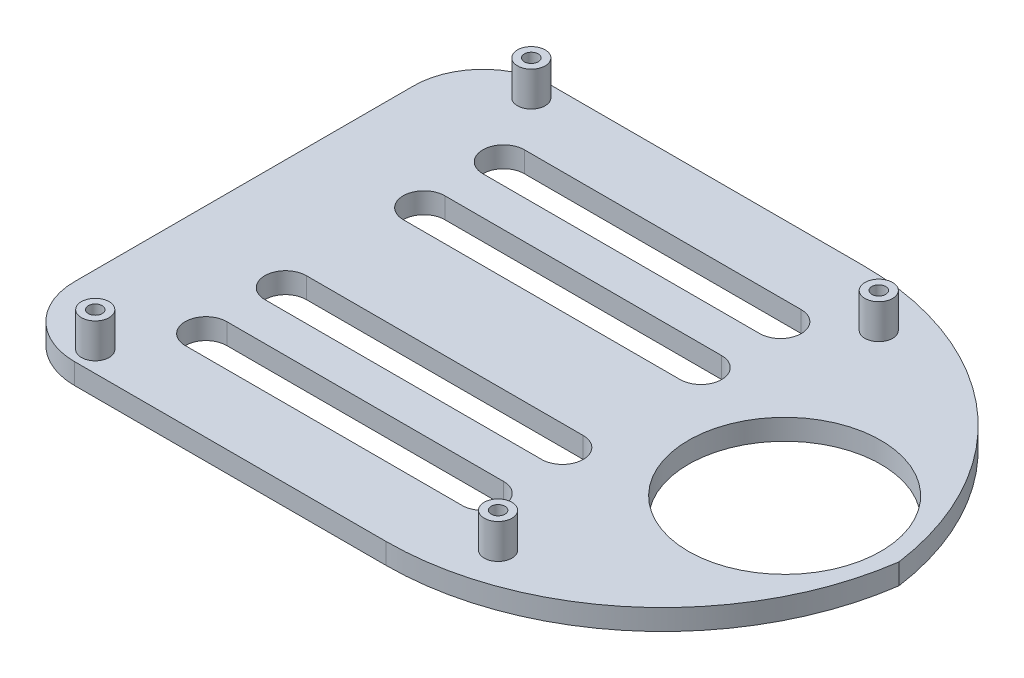
from build123d import *

# Parameters (mm, degrees)
ESBO_O1_W                = 95
ESBO_O1_H                = 69
RESSALTO_EXTRUS_O1_DEPTH = 3
ESBO_O2_R                = 13.9
CORTE_EXTRUS_O1_DEPTH    = 59.783501087
ESBO_O4_R                = 1
CORTE_EXTRUS_O2_DEPTH    = 59.783501087
RESSALTO_EXTRUS_O2_START = 5
ESBO_O5_R                = 2
ESBO_O5_R_2              = 1
RESSALTO_EXTRUS_O2_DEPTH = 5
FILETE1_R                = 40
FILETE2_R                = 10
CORTE_EXTRUS_O3_DEPTH    = 59.919436521


with BuildPart() as part:
    # Esboço1 → Ressalto-extrusão1 (new body)
    with BuildSketch(Plane(origin=(0, 0, 0), x_dir=(1, 0, 0), z_dir=(0, 1, 0))):
        Rectangle(ESBO_O1_W, ESBO_O1_H)
    extrude(amount=RESSALTO_EXTRUS_O1_DEPTH)

    # Esboço2 → Corte-extrusão1 (cut, through all)
    with BuildSketch(Plane(origin=(0, 3, 0), x_dir=(1, 0, 0), z_dir=(0, 1, 0))):
        with Locations(Location((30.6, 0, 0), (0, 0, 270))):
            Circle(ESBO_O2_R)
    extrude(amount=-CORTE_EXTRUS_O1_DEPTH, mode=Mode.SUBTRACT)

    # Esboço4 → Corte-extrusão2 (cut, through all)
    with BuildSketch(Plane(origin=(0, 3, 0), x_dir=(1, 0, 0), z_dir=(0, 1, 0))):
        with Locations(Location((16.7, 27.5, 0), (0, 0, 270))):
            Circle(ESBO_O4_R)
        with Locations(Location((16.7, -27.5, 0), (0, 0, 90))):
            Circle(ESBO_O4_R)
        with Locations(Location((-37.5, 31.5, 0), (0, 0, 270))):
            Circle(ESBO_O4_R)
        with Locations(Location((-37.5, -31.5, 0), (0, 0, 90))):
            Circle(ESBO_O4_R)
    extrude(amount=-CORTE_EXTRUS_O2_DEPTH, mode=Mode.SUBTRACT)

    # Esboço5 → Ressalto-extrusão2 (add)
    # profile 1 of 4: a face of its own
    with BuildSketch(Plane(origin=(0, 3, 0), x_dir=(1, 0, 0), z_dir=(0, 1, 0)).offset(RESSALTO_EXTRUS_O2_START)):
        with Locations(Location((-37.5, 31.5, 0), (0, 0, 270))):
            Circle(ESBO_O5_R)
        with Locations(Location((-37.5, 31.5, 0), (0, 0, 270))):
            Circle(ESBO_O5_R_2, mode=Mode.SUBTRACT)
    # profile 2 of 4: a face of its own
    with BuildSketch(Plane(origin=(0, 3, 0), x_dir=(1, 0, 0), z_dir=(0, 1, 0)).offset(RESSALTO_EXTRUS_O2_START)):
        with Locations(Location((16.7, 27.5, 0), (0, 0, 270))):
            Circle(ESBO_O5_R)
        with Locations(Location((16.7, 27.5, 0), (0, 0, 270))):
            Circle(ESBO_O5_R_2, mode=Mode.SUBTRACT)
    # profile 3 of 4: a face of its own
    with BuildSketch(Plane(origin=(0, 3, 0), x_dir=(1, 0, 0), z_dir=(0, 1, 0)).offset(RESSALTO_EXTRUS_O2_START)):
        with Locations(Location((16.7, -27.5, 0), (0, 0, 90))):
            Circle(ESBO_O5_R)
        with Locations(Location((16.7, -27.5, 0), (0, 0, 90))):
            Circle(ESBO_O5_R_2, mode=Mode.SUBTRACT)
    # profile 4 of 4: a face of its own
    with BuildSketch(Plane(origin=(0, 3, 0), x_dir=(1, 0, 0), z_dir=(0, 1, 0)).offset(RESSALTO_EXTRUS_O2_START)):
        with Locations(Location((-37.5, -31.5, 0), (0, 0, 90))):
            Circle(ESBO_O5_R)
        with Locations(Location((-37.5, -31.5, 0), (0, 0, 90))):
            Circle(ESBO_O5_R_2, mode=Mode.SUBTRACT)
    extrude(amount=-RESSALTO_EXTRUS_O2_DEPTH)

    # Filete1
    # the kernel refuses this fillet: 40 mm, written as the material it takes off along each edge
    with BuildSketch(Plane(origin=(47.5, -100, -34.5), x_dir=(-1, 0, 0), z_dir=(0, 1, 0))) as filete1_piece_1:
        with BuildLine():
            CenterArc((FILETE1_R, FILETE1_R), FILETE1_R, 180, 90)
            Line((0, FILETE1_R), (0, 0))
            Line((0, 0), (FILETE1_R, 0))
        make_face()
    extrude(amount=203, mode=Mode.SUBTRACT)
    with BuildSketch(Plane(origin=(47.5, -100, 34.5), x_dir=(-1, 0, 0), z_dir=(0, 1, 0))) as filete1_piece_2:
        with BuildLine():
            CenterArc((FILETE1_R, -FILETE1_R), FILETE1_R, 90, 90)
            Line((0, -FILETE1_R), (0, 0))
            Line((0, 0), (FILETE1_R, 0))
        make_face()
    extrude(amount=203, mode=Mode.SUBTRACT)

    # Filete2
    filete2_edges = [part.edges().sort_by_distance(p)[0] for p in [
        (-47.5, 1.5, 34.5),
        (-47.5, 1.5, -34.5),
    ]]
    fillet(filete2_edges, radius=FILETE2_R)

    # Esboço7 → Corte-extrusão3 (cut, through all)
    with BuildSketch(Plane(origin=(0, 3, 0), x_dir=(1, 0, 0), z_dir=(0, 1, 0))):
        with BuildLine():
            Line((-31.5, 13), (8.5, 13))
            ThreePointArc((8.5, 13), (11.5, 10), (8.5, 7))
            Line((8.5, 7), (-31.5, 7))
            ThreePointArc((-31.5, 7), (-34.5, 10), (-31.5, 13))
        make_face()
        with BuildLine():
            Line((-31.5, 24.5), (8.5, 24.5))
            ThreePointArc((8.5, 24.5), (11.5, 21.5), (8.5, 18.5))
            Line((8.5, 18.5), (-31.5, 18.5))
            ThreePointArc((-31.5, 18.5), (-34.5, 21.5), (-31.5, 24.5))
        make_face()
        with BuildLine():
            Line((-31.5, -24.5), (8.5, -24.5))
            ThreePointArc((8.5, -24.5), (11.5, -21.5), (8.5, -18.5))
            Line((8.5, -18.5), (-31.5, -18.5))
            ThreePointArc((-31.5, -18.5), (-34.5, -21.5), (-31.5, -24.5))
        make_face()
        with BuildLine():
            Line((-31.5, -13), (8.5, -13))
            ThreePointArc((8.5, -13), (11.5, -10), (8.5, -7))
            Line((8.5, -7), (-31.5, -7))
            ThreePointArc((-31.5, -7), (-34.5, -10), (-31.5, -13))
        make_face()
    extrude(amount=-CORTE_EXTRUS_O3_DEPTH, mode=Mode.SUBTRACT)


solid = part.part
